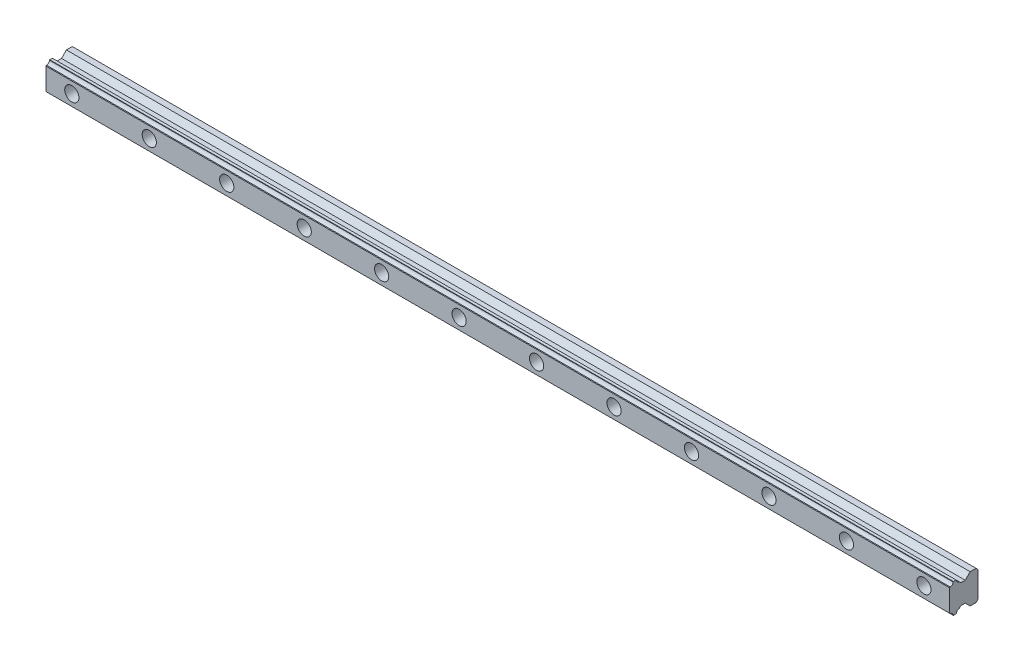
from build123d import *

# Parameters (mm, degrees)
BOSS_EXTRUDE1_DEPTH                     = 700
SKETCH2_W                               = 700
SKETCH2_H                               = 9.898648987
BOSS_EXTRUDE2_DEPTH                     = 3.8
SKETCH3_W                               = 700
SKETCH3_H                               = 6.0986495
BOSS_EXTRUDE3_DEPTH                     = 3.8
CUT_EXTRUDE1_DEPTH                      = 701.436906509
CUT_EXTRUDE2_DEPTH                      = 701.436906509
DRAFT1_ANGLE                            = 44.999996129
DRAFT2_ANGLE                            = 44.999996129
CBORE_FOR_M6_HEX_HEAD_BOLT1_D           = 7
CBORE_FOR_M6_HEX_HEAD_BOLT1_CBORE_D     = 11
CBORE_FOR_M6_HEX_HEAD_BOLT1_CBORE_DEPTH = 8.9
CHAMFER1_SIZE                           = 0.184878832
CHAMFER1_SIZE_2                         = 0.188416661
CHAMFER2_SIZE                           = 0.377828878
CHAMFER2_SIZE_2                         = 0.356334292
CHAMFER3_SIZE                           = 1.5


with BuildPart() as part:
    # Sketch1 → Boss-Extrude1 (new body)
    with BuildSketch(Plane(origin=(-20, 0, 0), x_dir=(0, -1, 0), z_dir=(-1, 0, 0))):
        with BuildLine():
            Line((-7.7, 0), (7.7, 0))
            Line((7.7, 0), (7.7, 13.280138132))
            Line((7.7, 13.280138132), (8.929704991, 14.509842724))
            ThreePointArc((8.929704991, 14.509842724), (9.732349977, 16.117560007), (11.4, 16.786841141))
            Line((11.4, 16.786841141), (11.4, 21.9))
            Line((11.4, 21.9), (-11.4, 21.9))
            Line((-11.4, 21.9), (-11.4, 16.786841141))
            ThreePointArc((-11.4, 16.786841141), (-9.732349977, 16.117560007), (-8.929704991, 14.509842724))
            Line((-8.929704991, 14.509842724), (-7.7, 13.280138132))
            Line((-7.7, 13.280138132), (-7.7, 0))
        make_face()
    extrude(amount=-BOSS_EXTRUDE1_DEPTH)

    # Sketch2 → Boss-Extrude2 (add)
    with BuildSketch(Plane.XZ.offset(7.7)):
        with Locations((330, 4.949324494)):
            Rectangle(SKETCH2_W, SKETCH2_H)
    extrude(amount=BOSS_EXTRUDE2_DEPTH)

    # Sketch3 → Boss-Extrude3 (add)
    with BuildSketch(Plane(origin=(0, 7.7, 0), x_dir=(-1, 0, 0), z_dir=(0, 1, 0))):
        with Locations((-330, 3.04932475)):
            Rectangle(SKETCH3_W, SKETCH3_H)
    extrude(amount=BOSS_EXTRUDE3_DEPTH)

    # Sketch4 → Cut-Extrude1 (cut, through all)
    with BuildSketch(Plane(origin=(680, 0, 0), x_dir=(0, 0, -1), z_dir=(1, 0, 0))):
        with BuildLine():
            Line((-21.9, -11.4), (-19.212914859, -11.4))
            ThreePointArc((-19.212914859, -11.4), (-20.027311235, -9.587199721), (-21.9, -8.921975628))
            Line((-21.9, -8.921975628), (-21.9, -11.4))
        make_face()
    extrude(amount=-CUT_EXTRUDE1_DEPTH, mode=Mode.SUBTRACT)

    # Sketch5 → Cut-Extrude2 (cut, through all)
    with BuildSketch(Plane(origin=(680, 0, 0), x_dir=(0, 0, -1), z_dir=(1, 0, 0))):
        with BuildLine():
            Line((-21.9, 11.4), (-21.9, 8.921975628))
            ThreePointArc((-21.9, 8.921975628), (-20.027311235, 9.587199721), (-19.212914859, 11.4))
            Line((-19.212914859, 11.4), (-21.9, 11.4))
        make_face()
    extrude(amount=-CUT_EXTRUDE2_DEPTH, mode=Mode.SUBTRACT)

    # Draft1
    draft1_faces = [part.faces().sort_by_distance(p)[0] for p in [
        (330, 9.6, 6.0986495),
    ]]
    draft(draft1_faces, Plane.ZX.offset(11.5), DRAFT1_ANGLE)

    # Draft2
    draft2_faces = [part.faces().sort_by_distance(p)[0] for p in [
        (330, -9.6, 9.898648987),
    ]]
    draft(draft2_faces, Plane(origin=(680, -7.7, 0), x_dir=(0, 0, -1), z_dir=(0, -1, 0)), DRAFT2_ANGLE)

    # CBORE for M6 Hex Head Bolt1 (through all)
    with Locations(Plane.XY.offset(21.9)):
        with Locations((60, 0), (120, 0), (180, 0), (240, 0), (300, 0), (360, 0), (420, 0), (480, 0), (540, 0), (600, 0), (660, 0), (0, 0)):
            CounterBoreHole(CBORE_FOR_M6_HEX_HEAD_BOLT1_D / 2, CBORE_FOR_M6_HEX_HEAD_BOLT1_CBORE_D / 2, CBORE_FOR_M6_HEX_HEAD_BOLT1_CBORE_DEPTH)

    # Chamfer1
    # the kernel refuses this chamfer: 0.188416661, 0.184878832 mm, written as the material it takes off along each edge
    with BuildSketch(Plane(origin=(-20.505430952, 11.4, 16.786841141), x_dir=(0, -0.9983504789140061, -0.057413598146908586), z_dir=(1, 0, 0))) as chamfer1_piece_1:
        with BuildLine():
            Line((0.196483777, 0), (-CHAMFER1_SIZE * 0.0574135982779, -CHAMFER1_SIZE * 0.998350481192))
            Line((-CHAMFER1_SIZE * 0.0574135982779, -CHAMFER1_SIZE * 0.998350481192), (0, 0))
            ThreePointArc((0, 0), (0.101060009, -0.001906555), (0.196483777, 0))
        make_face()
    extrude(amount=701.010861905, mode=Mode.SUBTRACT)
    with BuildSketch(Plane(origin=(680.505430952, 11.4, 19.212914859), x_dir=(0, 0, -1), z_dir=(-1, 0, 0))) as chamfer1_piece_2:
        with BuildLine():
            Line((CHAMFER1_SIZE * 1.00000000228, 0), (-0.011280841, 0.196159673))
            ThreePointArc((-0.011280841, 0.196159673), (-0.003898809, 0.10100277), (0, 0))
            Line((0, 0), (CHAMFER1_SIZE * 1.00000000228, 0))
        make_face()
    extrude(amount=701.010861905, mode=Mode.SUBTRACT)
    with BuildSketch(Plane(origin=(-20.49480589, -11.4, 16.786841141), x_dir=(0, 0, 1), z_dir=(1, 0, 0))) as chamfer1_piece_3:
        with BuildLine():
            Line((CHAMFER1_SIZE_2 * 1.0000000015, 0), (-0.010884434, -0.192019871))
            ThreePointArc((-0.010884434, -0.192019871), (-0.003775118, -0.098877649), (0, 0))
            Line((0, 0), (CHAMFER1_SIZE_2 * 1.0000000015, 0))
        make_face()
    extrude(amount=700.98961178, mode=Mode.SUBTRACT)
    with BuildSketch(Plane(origin=(680.49480589, -11.4, 19.212914859), x_dir=(0, 0.9983973290920217, 0.05659304959018505), z_dir=(-1, 0, 0))) as chamfer1_piece_4:
        with BuildLine():
            Line((0.19232811, 0), (-CHAMFER1_SIZE_2 * 0.0565930496749, CHAMFER1_SIZE_2 * 0.998397330587))
            Line((-CHAMFER1_SIZE_2 * 0.0565930496749, CHAMFER1_SIZE_2 * 0.998397330587), (0, 0))
            ThreePointArc((0, 0), (0.098932826, 0.00182672), (0.19232811, 0))
        make_face()
    extrude(amount=700.98961178, mode=Mode.SUBTRACT)

    # Chamfer2
    # the kernel refuses this chamfer: 0.377828878, 0.356334292 mm, written as the material it takes off along each edge
    with BuildSketch(Plane(origin=(680.984980067, -8.921975628, 21.9), x_dir=(0, 1, 0), z_dir=(-1, 0, 0))) as chamfer2_piece_1:
        with BuildLine():
            Line((CHAMFER2_SIZE, 0), (-0.005157634, 0.382986696))
            ThreePointArc((-0.005157634, 0.382986696), (0.004600101, 0.197032231), (0, 0))
            Line((0, 0), (CHAMFER2_SIZE, 0))
        make_face()
    extrude(amount=701.969960134, mode=Mode.SUBTRACT)
    with BuildSketch(Plane(origin=(681.061335524, 8.921975628, 21.9), x_dir=(0, 0.01938777487044788, -0.9998120394281981), z_dir=(-1, 0, 0))) as chamfer2_piece_2:
        with BuildLine():
            Line((0.412898561, 0), (-CHAMFER2_SIZE_2 * 0.0193877748633, CHAMFER2_SIZE_2 * 0.999812039061))
            Line((-CHAMFER2_SIZE_2 * 0.0193877748633, CHAMFER2_SIZE_2 * 0.999812039061), (0, 0))
            ThreePointArc((0, 0), (0.212241278, 0.008430622), (0.412898561, 0))
        make_face()
    extrude(amount=702.122671049, mode=Mode.SUBTRACT)

    # Chamfer3
    chamfer3_edges = [part.edges().sort_by_distance(p)[0] for p in [
        (330, -11.5, 0),
        (330, 11.5, 0),
    ]]
    chamfer(chamfer3_edges, length=CHAMFER3_SIZE)


solid = part.part
